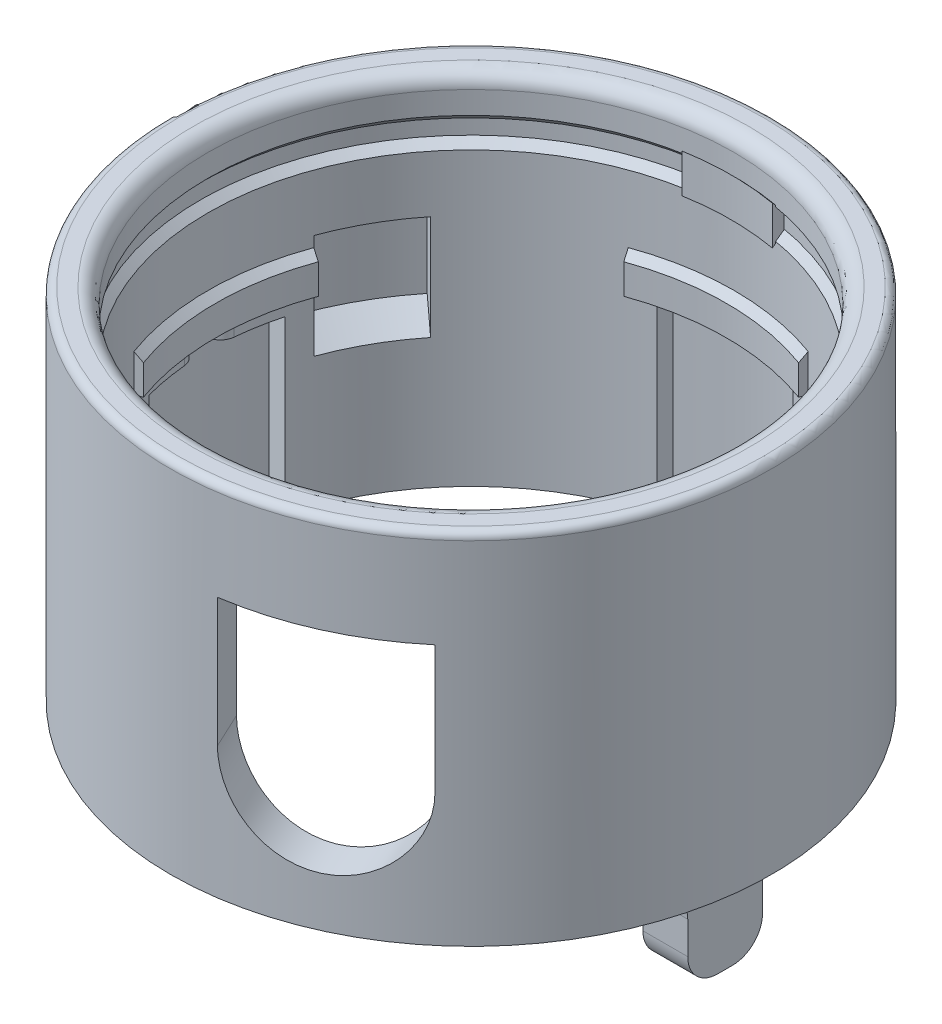
from build123d import *

# Parameters (mm, degrees)
REVOLVE4_ANGLE           = 10
REVOLVE4_OTHER_WAY_ANGLE = 10
SKETCH7_W                = 2.5
SKETCH7_H                = 17
REVOLVE6_ANGLE           = 40
CUT_EXTRUDE2_START       = -16
CUT_EXTRUDE2_DEPTH       = 16
FILLET1_R                = 0.5
CUT_EXTRUDE3_START       = -12.5
CUT_EXTRUDE3_DEPTH       = 12.5
CUT_EXTRUDE4_START       = -11.5
CUT_EXTRUDE4_DEPTH       = 11.5
CUT_EXTRUDE5_START       = -12.5
CUT_EXTRUDE5_DEPTH       = 12.5
FILLET2_R                = 1
SKETCH13_W               = 11
SKETCH13_H               = 8.6
CUT_EXTRUDE6_DEPTH       = 5
CIRPATTERN1_COUNT        = 4
BOSS_EXTRUDE1_DEPTH      = 7
BOSS_EXTRUDE2_DEPTH      = 3
FILLET3_R                = 1
CUT_EXTRUDE7_DEPTH       = 2
CUT_EXTRUDE7_DEPTH_BACK  = 5
CHAMFER1_SIZE            = 1.5


# Read off the part's stored shape, not the designer's step: Revolve6
# Some blends are built 0.0001 mm under size
with BuildPart() as part:
    # Sketch1 → Revolve3 (revolve)
    with BuildSketch(Plane(origin=(0, 0, 0), x_dir=(0, 0, -1), z_dir=(1, 0, 0))):
        with BuildLine():
            Line((17.6, 0), (17.6, 2.5))
            Line((17.6, 2.5), (18.1, 3))
            Line((18.1, 3), (18.1, 4))
            Line((18.1, 4), (17.6, 4.5))
            Line((17.6, 4.5), (17.6, 6))
            ThreePointArc((17.6, 6), (17.892893219, 6.707106781), (18.6, 7))
            Line((18.6, 7), (19.6, 7))
            ThreePointArc((19.6, 7), (19.953553391, 6.853553391), (20.1, 6.5))
            Line((20.1, 6.5), (20.1, 0))
            Line((20.1, 0), (17.6, 0))
        make_face()
    revolve(axis=Axis((0, 0, 0), (0, 1, 0)))

    # Sketch7 → Revolve5 (revolve)
    with BuildSketch(Plane(origin=(0, 0, 0), x_dir=(0, 0, -1), z_dir=(1, 0, 0))):
        with Locations((18.85, -8.5)):
            Rectangle(SKETCH7_W, SKETCH7_H)
    revolve(axis=Axis((0, 9.361699771, 0), (0, -1, 0)))

    # Revolve6 outline → Revolve6 (revolve)
    with BuildSketch(Plane(origin=(0, 0, 0), x_dir=(0.3420201433256701, 0, -0.9396926207859079), z_dir=(0.9396926207859079, 0, 0.3420201433256701))):
        Polygon((17.1, -2.5), (17.1, -4.5), (17.6, -4.5), (17.6, -2), align=None)
    revolve6 = revolve(axis=Axis((0, 0, 0), (0, 1, 0)), revolution_arc=REVOLVE6_ANGLE)

    # Sketch11 → Cut-Extrude2 (cut)
    with BuildSketch(Plane.XZ.offset(17).offset(CUT_EXTRUDE2_START)):
        with BuildLine():
            Line((-8.771705355, 15.824575355), (-8.532649316, 15.393306846))
            ThreePointArc((-8.532649316, 15.393306846), (-10.34502044, 14.238699101), (-12.003171137, 12.871825148))
            Line((-12.003171137, 12.871825148), (-12.339459485, 13.23245025))
            ThreePointArc((-12.339459485, 13.23245025), (-12.47318933, 13.597800043), (-12.30455011, 13.948406597))
            ThreePointArc((-12.30455011, 13.948406597), (-10.932805693, 15.047716095), (-9.463407894, 16.012617245))
            ThreePointArc((-9.463407894, 16.012617245), (-9.077848861, 16.06465929), (-8.771705355, 15.824575355))
        make_face()
    extrude(amount=CUT_EXTRUDE2_DEPTH, mode=Mode.SUBTRACT)

    # Fillet1
    fillet1_edges = [part.edges().sort_by_distance(p)[0] for p in [
        (-12.003171137, -9, 12.871825148),
        (-8.532649316, -9, 15.393306846),
    ]]
    fillet(fillet1_edges, radius=FILLET1_R - 0.0001)  # a hair under: the kernel refuses the full size

    # Sketch8 → Cut-Extrude3 (cut)
    with BuildSketch(Plane(origin=(0, -17, 0), x_dir=(-1, 0, 0), z_dir=(0, -1, 0)).offset(CUT_EXTRUDE3_START)):
        with BuildLine():
            ThreePointArc((4.555215194, 17.000294543), (0, 17.6), (-4.555215194, 17.000294543))
            Line((-4.555215194, 17.000294543), (-4.943443761, 18.449183282))
            ThreePointArc((-4.943443761, 18.449183282), (0, 19.1), (4.943443761, 18.449183282))
            Line((4.943443761, 18.449183282), (4.555215194, 17.000294543))
        make_face()
    extrude(amount=CUT_EXTRUDE3_DEPTH, mode=Mode.SUBTRACT)

    # Sketch8<3> → Cut-Extrude4 (cut)
    with BuildSketch(Plane(origin=(0, -17, 0), x_dir=(-1, 0, 0), z_dir=(0, -1, 0)).offset(CUT_EXTRUDE4_START)):
        with BuildLine():
            Line((17.000294543, 4.555215194), (18.449183282, 4.943443761))
            ThreePointArc((18.449183282, 4.943443761), (19.1, 0), (18.449183282, -4.943443761))
            Line((18.449183282, -4.943443761), (17.000294543, -4.555215194))
            ThreePointArc((17.000294543, -4.555215194), (17.6, 0), (17.000294543, 4.555215194))
        make_face()
        with BuildLine():
            Line((-17.000294543, -4.555215194), (-18.449183282, -4.943443761))
            ThreePointArc((-18.449183282, -4.943443761), (-19.1, 0), (-18.449183282, 4.943443761))
            Line((-18.449183282, 4.943443761), (-17.000294543, 4.555215194))
            ThreePointArc((-17.000294543, 4.555215194), (-17.6, 0), (-17.000294543, -4.555215194))
        make_face()
    extrude(amount=CUT_EXTRUDE4_DEPTH, mode=Mode.SUBTRACT)

    # Sketch8<4> → Cut-Extrude5 (cut)
    with BuildSketch(Plane(origin=(0, -17, 0), x_dir=(-1, 0, 0), z_dir=(0, -1, 0)).offset(CUT_EXTRUDE5_START)):
        with BuildLine():
            Line((-19.085269189, -0.75), (-17.584012625, -0.75))
            ThreePointArc((-17.584012625, -0.75), (-17.6, 0), (-17.584012625, 0.75))
            Line((-17.584012625, 0.75), (-19.085269189, 0.75))
            ThreePointArc((-19.085269189, 0.75), (-19.1, 0), (-19.085269189, -0.75))
        make_face()
        with BuildLine():
            Line((19.085269189, 0.75), (17.584012625, 0.75))
            ThreePointArc((17.584012625, 0.75), (17.6, 0), (17.584012625, -0.75))
            Line((17.584012625, -0.75), (19.085269189, -0.75))
            ThreePointArc((19.085269189, -0.75), (19.1, 0), (19.085269189, 0.75))
        make_face()
    extrude(amount=CUT_EXTRUDE5_DEPTH, mode=Mode.SUBTRACT)

    # Fillet2
    fillet2_edges = [part.edges().sort_by_distance(p)[0] for p in [
        (17.584012625, -5, 0.75),
        (17.584012625, -5, -0.75),
        (-17.584012625, -5, -0.75),
        (-17.584012625, -5, 0.75),
    ]]
    fillet(fillet2_edges, radius=FILLET2_R)

    # Sketch13 → Cut-Extrude6 (cut)
    with BuildSketch(Plane(origin=(8.494627061, 0, 18.216786519), x_dir=(0.9063077870366499, 0, -0.42261826174069955), z_dir=(0.42261826174069955, 0, 0.9063077870366499))):
        with BuildLine():
            ThreePointArc((5.245888847, -8.175), (-0.254111153, -13.675), (-5.754111153, -8.175))
            Line((-5.754111153, -8.175), (5.245888847, -8.175))
        make_face()
        with Locations((-0.254111153, -3.875)):
            Rectangle(SKETCH13_W, SKETCH13_H)
    extrude(amount=-CUT_EXTRUDE6_DEPTH, mode=Mode.SUBTRACT)

    # CirPattern1: Revolve6 ×4 about axis, 1 skipped
    cirpattern1_axis = Axis((0, 7, 0), (0, -1, 0))
    add([revolve6.rotate(cirpattern1_axis, i * 360 / CIRPATTERN1_COUNT) for i in range(1, CIRPATTERN1_COUNT) if i not in (2,)])

    # Sketch17 → Cut-Extrude7 (cut, two sides: drawn at the far end of the back side and taken through both)
    with BuildSketch(Plane(origin=(0, -6.3, 0), x_dir=(-1, 0, 0), z_dir=(0, -1, 0)).offset(-CUT_EXTRUDE7_DEPTH_BACK)):
        with BuildLine():
            Line((17.948129057, 6.532584738), (16.538590126, 6.019554523))
            ThreePointArc((16.538590126, 6.019554523), (15.336093031, 8.635059382), (13.723316586, 11.019554523))
            Line((13.723316586, 11.019554523), (14.892917432, 11.958721101))
            ThreePointArc((14.892917432, 11.958721101), (16.643146415, 9.371001943), (17.948129057, 6.532584738))
        make_face()
    extrude(amount=CUT_EXTRUDE7_DEPTH + CUT_EXTRUDE7_DEPTH_BACK, mode=Mode.SUBTRACT)

    # Chamfer1
    chamfer1_edges = [part.edges().sort_by_distance(p)[0] for p in [
        (-16.643146415, -8.3, -9.371001943),
    ]]
    chamfer(chamfer1_edges, length=CHAMFER1_SIZE - 0.0001)  # a hair under: the kernel refuses the full size


with BuildPart() as body_2:
    # Sketch6 → Revolve4 (revolve)
    with BuildSketch(Plane(origin=(0, 0, 0), x_dir=(0, 0, -1), z_dir=(1, 0, 0))):
        Polygon((18.1, 4.1), (17.4, 4.8), (17.4, 2.2), (18.1, 2.9), (18.1, 3), (18.1, 4), align=None)
    revolve(axis=Axis((0, 0, 0), (0, 1, 0)), revolution_arc=REVOLVE4_ANGLE)

    # Sketch6 → Revolve4 other way (revolve)
    with BuildSketch(Plane(origin=(0, 0, 0), x_dir=(0, 0, -1), z_dir=(1, 0, 0))):
        Polygon((18.1, 4.1), (17.4, 4.8), (17.4, 2.2), (18.1, 2.9), (18.1, 3), (18.1, 4), align=None)
    revolve(axis=Axis((0, 0, 0), (0, -1, 0)), revolution_arc=REVOLVE4_OTHER_WAY_ANGLE)


with BuildPart() as body_3:
    # Sketch14 → Boss-Extrude1 (new body)
    with BuildSketch(Plane.XZ.offset(17)):
        Polygon((14.000294543, -4.555215194), (17.000294543, -4.555215194), (18.449183282, -4.943443761), (18.988728028, -2.05869082), (18.988728028, 2.05869082), (18.449183282, 4.943443761), (17.000294543, 4.555215194), (14.000294543, 4.555215194), align=None)
    extrude(amount=-BOSS_EXTRUDE1_DEPTH)

    # Sketch15 → Boss-Extrude2 (add)
    with BuildSketch(Plane.ZY.offset(-14.000294543)):
        with BuildLine():
            Line((-4.555215194, -17), (-3.085786438, -18.469428756))
            ThreePointArc((-3.085786438, -18.469428756), (-2.652240935, -19.118275454), (-2.5, -19.883642319))
            Line((-2.5, -19.883642319), (-2.5, -22.055215194))
            ThreePointArc((-2.5, -22.055215194), (-1.914213562, -23.469428756), (-0.5, -24.055215194))
            Line((-0.5, -24.055215194), (0.5, -24.055215194))
            ThreePointArc((0.5, -24.055215194), (1.914213562, -23.469428756), (2.5, -22.055215194))
            Line((2.5, -22.055215194), (2.5, -19.883642319))
            ThreePointArc((2.5, -19.883642319), (2.652240935, -19.118275454), (3.085786438, -18.469428756))
            Line((3.085786438, -18.469428756), (4.555215194, -17))
            Line((4.555215194, -17), (-4.555215194, -17))
        make_face()
    extrude(amount=-BOSS_EXTRUDE2_DEPTH)

    # Fillet3
    # the kernel refuses this fillet: 1 mm, written as the material it adds along each edge
    with BuildSketch(Plane(origin=(17.000294543, -17, 7.055215194), x_dir=(1, 0, 0), z_dir=(0, 0, -1))) as fillet3_piece_1_section:
        with BuildLine():
            CenterArc((FILLET3_R, FILLET3_R), FILLET3_R, 180, 90)
            Line((0, FILLET3_R), (0, 0))
            Line((0, 0), (FILLET3_R, 0))
        make_face()
    fillet3_piece_1 = extrude(amount=14.110430388, mode=Mode.PRIVATE)
    fillet3_piece_1 = split(fillet3_piece_1, bisect_by=Plane(origin=(17.233034532, -19.385437928, -2.169777266), z_dir=(0, 0.7071067811865458, 0.7071067811865492)), keep=Keep.TOP, mode=Mode.PRIVATE)
    fillet3_piece_1 = split(fillet3_piece_1, bisect_by=Plane(origin=(17.233034532, -19.385437928, 2.169777266), z_dir=(0, 0.7071067811865461, -0.7071067811865489)), keep=Keep.TOP, mode=Mode.PRIVATE)
    add(fillet3_piece_1)


solid = Compound([part.part, body_2.part, body_3.part])
